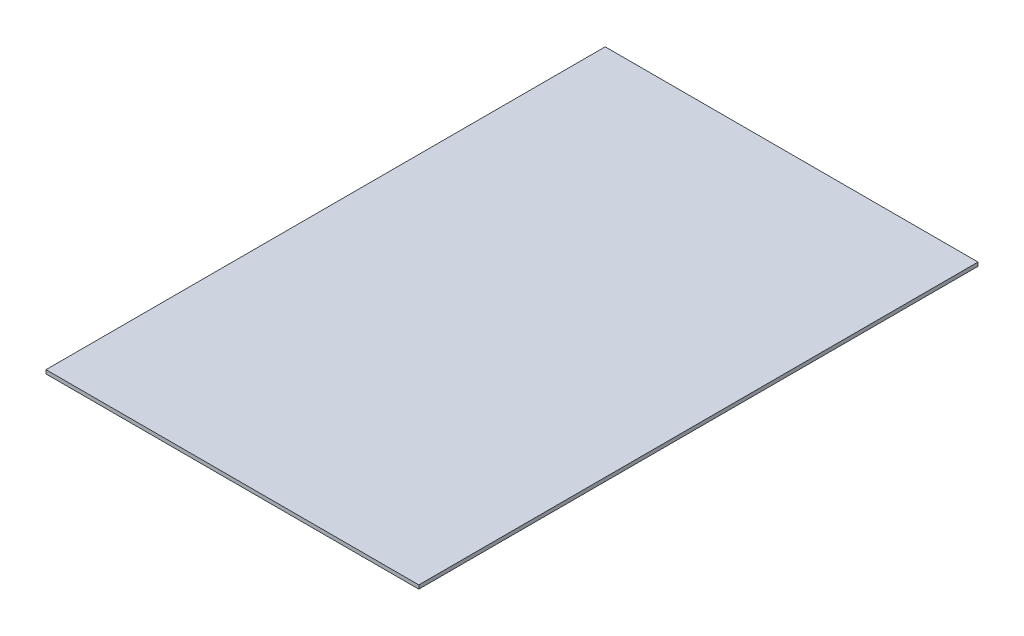
from build123d import *

# Parameters (mm, degrees)
SZKIC1_W                    = 10000
SZKIC1_H                    = 15000
DODANIE_WYCI_GNI_CIE1_DEPTH = 100


with BuildPart() as part:
    # Szkic1 → Dodanie-wyciągnięcie1 (new body)
    with BuildSketch(Plane(origin=(0, 0, 0), x_dir=(1, 0, 0), z_dir=(0, 1, 0))):
        Rectangle(SZKIC1_W, SZKIC1_H)
    extrude(amount=DODANIE_WYCI_GNI_CIE1_DEPTH)


solid = part.part
